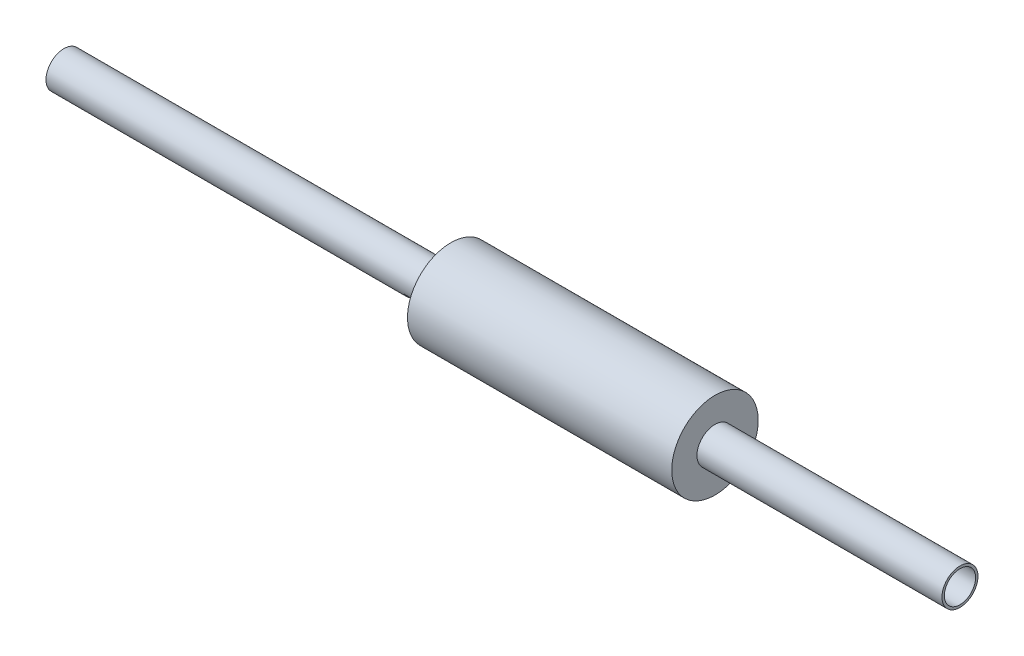
from build123d import *

# Parameters (mm, degrees)
CUT_EXTRUDE1_REACH = 219.495
SKETCH2_W          = 8
SKETCH2_H          = 13


with BuildPart() as part:
    # Sketch1 → Revolve1 (revolve)
    with BuildSketch(Plane.XY):
        Polygon((157, 6.5), (157, 7.5), (55, 7.5), (55, 18), (-55, 18), (-55, 7.5), (-216, 7.5), (-216, 6.5), align=None)
    revolve(axis=Axis((196.356223274, 0, 0), (-1, 0, 0)))

    # Sketch2 → Cut-Extrude1 (cut, up to next)
    with BuildSketch(Plane(origin=(0, 0, 0), x_dir=(1, 0, 0), z_dir=(0, 1, 0)), mode=Mode.PRIVATE) as cut_extrude1_sk1:
        with Locations((-64, 0)):
            Rectangle(SKETCH2_W, SKETCH2_H)
    cut_extrude1_tool1 = extrude(cut_extrude1_sk1.sketch, amount=-CUT_EXTRUDE1_REACH, mode=Mode.PRIVATE) & part.part
    add(cut_extrude1_tool1.solids().sort_by_distance((-64, 0, 0))[0], mode=Mode.SUBTRACT)


solid = part.part
